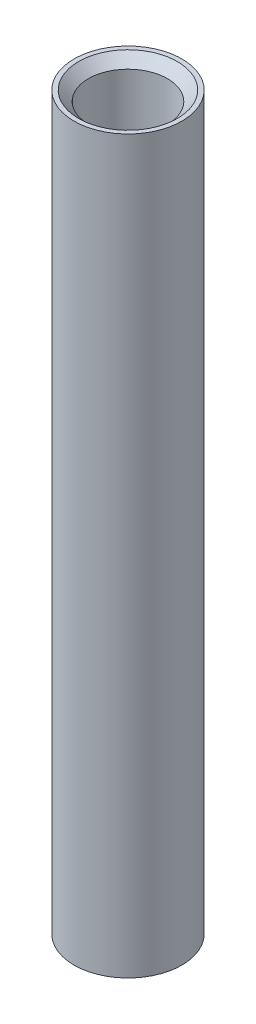
from build123d import *

# Parameters (mm, degrees)
SKETCH1_R           = 27.3
SKETCH1_R_2         = 20
BOSS_EXTRUDE1_DEPTH = 370.2
CHAMFER2_SIZE       = 5


with BuildPart() as part:
    # Sketch1 → Boss-Extrude1 (new body)
    with BuildSketch(Plane(origin=(0, 0, 0), x_dir=(1, 0, 0), z_dir=(0, 1, 0))):
        Circle(SKETCH1_R)
        Circle(SKETCH1_R_2, mode=Mode.SUBTRACT)
    extrude(amount=BOSS_EXTRUDE1_DEPTH)

    # Chamfer2
    chamfer2_edges = [part.edges().sort_by_distance(p)[0] for p in [
        (-20, 370.2, 0),
    ]]
    chamfer(chamfer2_edges, length=CHAMFER2_SIZE)


solid = part.part
